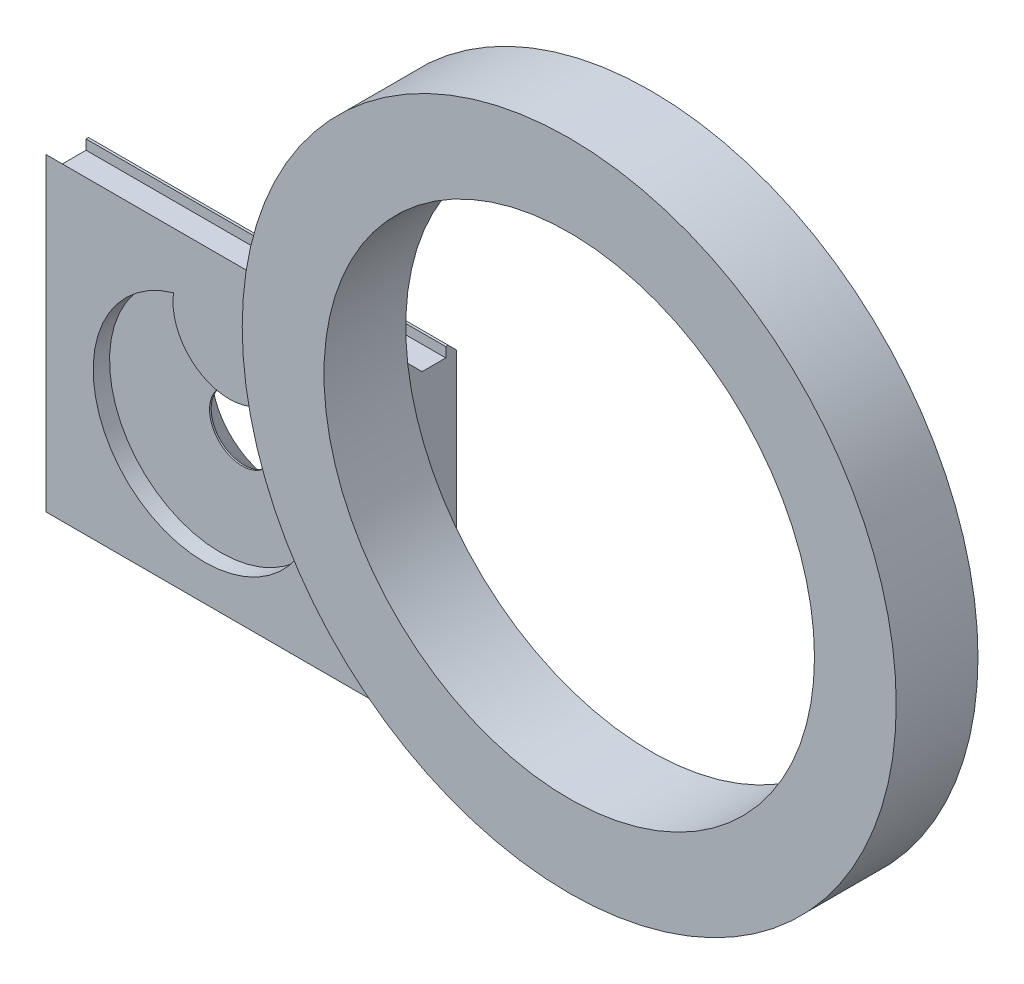
from build123d import *

# Parameters (mm, degrees)
BOSS_EXTRUDE1_DEPTH                          = 22
CUT_EXTRUDE1_DEPTH                           = 31.044799883
CUT_EXTRUDE1_DEPTH_BACK                      = 31.044799883
SKETCH4_R                                    = 4
CHAMFER1_SIZE                                = 1
CHAMFER2_SIZE                                = 4
CSK_FOR_M3_COUNTERSUNK_FLAT_HEAD_SCR_2_COUNT = 2
CSK_FOR_M3_COUNTERSUNK_FLAT_HEAD_SCR_2_PITCH = 21
CSK_FOR_M3_COUNTERSUNK_FLAT_HEAD_SCR_3_COUNT = 2
CSK_FOR_M3_COUNTERSUNK_FLAT_HEAD_SCR_3_PITCH = 24.43869882
CSK_FOR_M3_COUNTERSUNK_FLAT_HEAD_SCR_4_COUNT = 2
CSK_FOR_M3_COUNTERSUNK_FLAT_HEAD_SCR_4_PITCH = 12.5
FILLET1_R                                    = 0.2
CUT_EXTRUDE2_DEPTH                           = 2
SKETCH9_R                                    = 40
SKETCH9_R_2                                  = 30
BOSS_EXTRUDE2_DEPTH                          = 10


with BuildPart() as part:
    # Sketch2 → Boss-Extrude1 (new, symmetric)
    with BuildSketch(Plane(origin=(0, 0, 0), x_dir=(0, 0, -1), z_dir=(1, 0, 0))):
        Polygon((2, 17.5), (4.9, 17.5), (4.9, 18.7), (6.2, 18.7), (6.2, -15.652479139), (3, -17.5), (3, -18.366025404), (1.5, -17.5), (0, -18.366025404), (0, -17.5), (0, 17.5), (0, 19.5), align=None)
    extrude(amount=BOSS_EXTRUDE1_DEPTH, both=True)

    # Sketch4 → Cut-Extrude1 (cut, two sides: drawn at the far end of the back side and taken through both)
    with BuildSketch(Plane.XY.offset(-CUT_EXTRUDE1_DEPTH_BACK)):
        with Locations((0, 0.5)):
            Circle(SKETCH4_R)
    extrude(amount=CUT_EXTRUDE1_DEPTH + CUT_EXTRUDE1_DEPTH_BACK, mode=Mode.SUBTRACT)

    # Chamfer1
    chamfer1_edges = [part.edges().sort_by_distance(p)[0] for p in [
        (0, 18.7, -6.2),
    ]]
    chamfer(chamfer1_edges, length=CHAMFER1_SIZE)

    # Chamfer2
    chamfer2_edges = [part.edges().sort_by_distance(p)[0] for p in [
        (-4, 0.5, -6.2),
    ]]
    chamfer(chamfer2_edges, length=CHAMFER2_SIZE)

    # Sketch7 → CSK for M3 Countersunk Flat Head Screw1 (revolve, cut)
    with BuildSketch(Plane(origin=(10.5, 12.5, -6.2), x_dir=(0, 1, 0), z_dir=(1, 0, 0))):
        Polygon((0, 0), (0, 3.030043031), (0.05, 3), (0.05, 3.1), (3.15, 0), align=None)
    csk_for_m3_countersunk_flat_head_screw1 = revolve(axis=Axis((10.5, 12.5, -12.55), (0, 0, 1)), mode=Mode.SUBTRACT)

    # CSK for M3 Countersunk Flat Head Scr 2: CSK for M3 Countersunk Flat Head Screw1 ×2
    with Locations(*[(-i * CSK_FOR_M3_COUNTERSUNK_FLAT_HEAD_SCR_2_PITCH, 0, 0) for i in range(1, CSK_FOR_M3_COUNTERSUNK_FLAT_HEAD_SCR_2_COUNT)]):
        add(csk_for_m3_countersunk_flat_head_screw1, mode=Mode.SUBTRACT)

    # CSK for M3 Countersunk Flat Head Scr 3: CSK for M3 Countersunk Flat Head Screw1 ×2
    with Locations(*[Vector(-0.8592928844097067, -0.5114838597676826, 0) * (i * CSK_FOR_M3_COUNTERSUNK_FLAT_HEAD_SCR_3_PITCH) for i in range(1, CSK_FOR_M3_COUNTERSUNK_FLAT_HEAD_SCR_3_COUNT)]):
        add(csk_for_m3_countersunk_flat_head_screw1, mode=Mode.SUBTRACT)

    # CSK for M3 Countersunk Flat Head Scr 4: CSK for M3 Countersunk Flat Head Screw1 ×2
    with Locations(*[(0, -i * CSK_FOR_M3_COUNTERSUNK_FLAT_HEAD_SCR_4_PITCH, 0) for i in range(1, CSK_FOR_M3_COUNTERSUNK_FLAT_HEAD_SCR_4_COUNT)]):
        add(csk_for_m3_countersunk_flat_head_screw1, mode=Mode.SUBTRACT)

    # Fillet1
    fillet1_edges = [part.edges().sort_by_distance(p)[0] for p in [
        (0, -18.366025404, -3),
    ]]
    fillet(fillet1_edges, radius=FILLET1_R)

    # Sketch3 → Cut-Extrude2 (cut)
    with BuildSketch(Plane.XY):
        with BuildLine():
            ThreePointArc((6.875473952, 9.29422206), (-1.27095435, 5.012578964), (-6.403163839, 12.651766581))
            ThreePointArc((-6.403163839, 12.651766581), (-5.971888857, -13.578985861), (6.875473952, 9.29422206))
        make_face()
    extrude(amount=-CUT_EXTRUDE2_DEPTH, mode=Mode.SUBTRACT)


with BuildPart() as body_2:
    # Sketch9 → Boss-Extrude2 (new body)
    with BuildSketch(Plane.XY):
        with Locations((52, 23.246987298)):
            Circle(SKETCH9_R)
        with Locations((52, 23.246987298)):
            Circle(SKETCH9_R_2, mode=Mode.SUBTRACT)
    extrude(amount=BOSS_EXTRUDE2_DEPTH)


solid = Compound([part.part, body_2.part])
